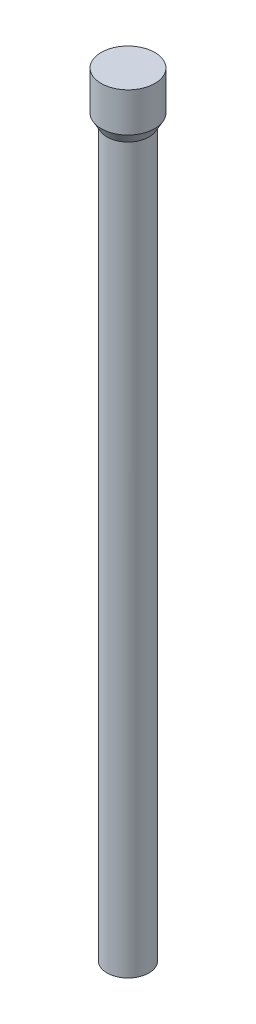
from build123d import *

# Parameters (mm, degrees)
SKETCH_1_R       = 2.5
EXTRUDE_1_DEPTH  = 2
SKETCH_2_R       = 1.95
EXTRUDE_2_DEPTH  = 70
CHAMFER_1_SIZE   = 1.5
CHAMFER_1_SIZE_2 = 2.598076211


with BuildPart() as part:
    # 草图1 → 凸台-拉伸1 (new body)
    with BuildSketch(Plane(origin=(0, 0, 0), x_dir=(1, 0, 0), z_dir=(0, 1, 0))):
        with Locations(Location((0, 0, 0), (0, 0, 270))):
            Circle(SKETCH_1_R)
    extrude(amount=EXTRUDE_1_DEPTH)

    # 草图2 → 凸台-拉伸2 (add)
    with BuildSketch(Plane.XZ):
        with Locations(Location((0, 0, 0), (0, 0, 270))):
            Circle(SKETCH_2_R)
    extrude(amount=EXTRUDE_2_DEPTH)

    # 倒角1
    # the kernel refuses this chamfer: 2.598076211, 1.5 mm, written as the material it adds along each edge
    with BuildSketch(Plane(origin=(0, 0, 0), x_dir=(0, 0, -1), z_dir=(-1, 0, 0))) as chamfer_1_piece_1_section:
        Polygon((1.95 + CHAMFER_1_SIZE, 0), (1.95, CHAMFER_1_SIZE_2), (1.95, 0), align=None)
    chamfer_1_piece_1 = revolve(axis=Axis((0, 0, 0), (0, -1, 0)), mode=Mode.PRIVATE)
    chamfer_1_piece_1 = chamfer_1_piece_1 & Plane(origin=(0, -2.153550613, 0), x_dir=(0, 0, 1), z_dir=(0, -1, 0)) * Cylinder(2.5, 14, mode=Mode.PRIVATE)
    add(chamfer_1_piece_1)


solid = part.part
